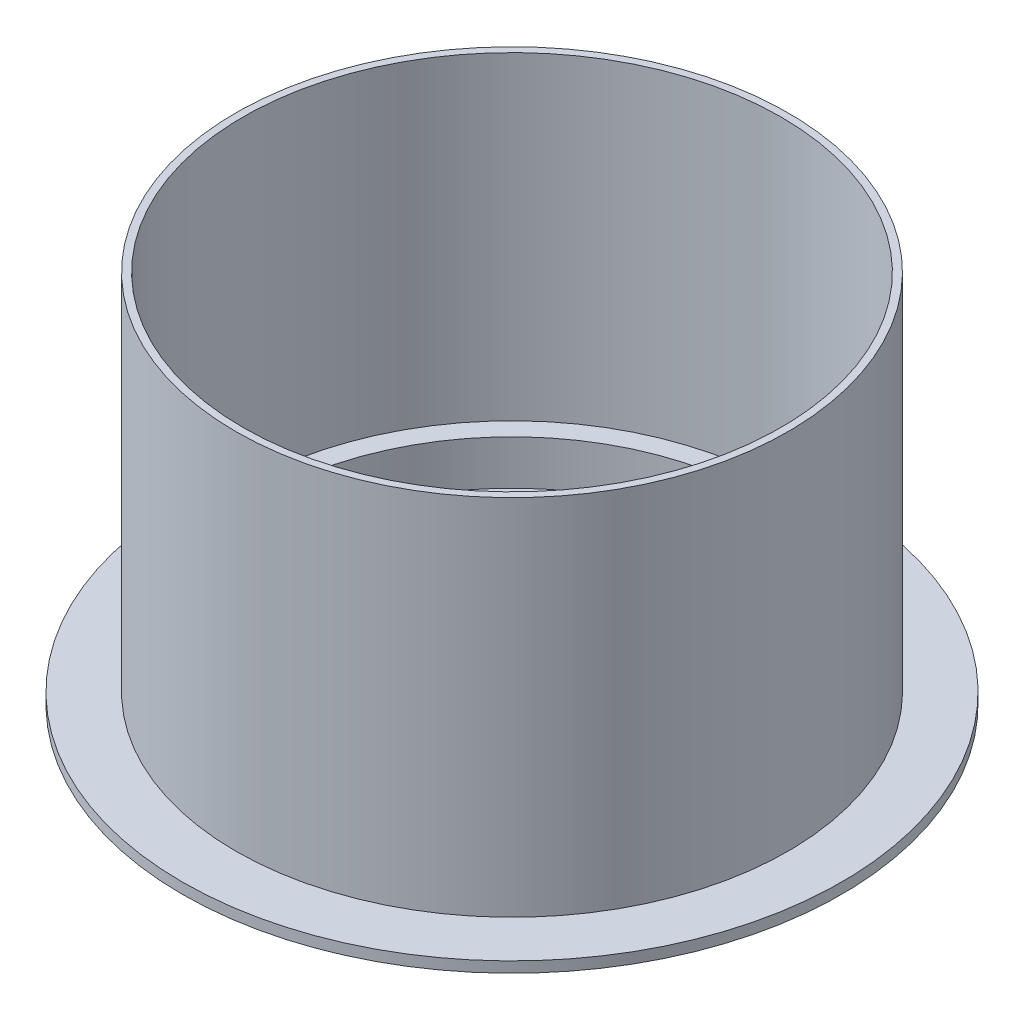
from build123d import *

# Parameters (mm, degrees)
FLOOR_SKETCH_R          = 185
FLOOR_SKETCH_R_2        = 12.5
FLOOR_TANK_LID_DEPTH    = 6
BASKET_LEDGE_SKETCH_R   = 152
BASKET_LEDGE_SKETCH_R_2 = 140
BASKET_LEDGE_DEPTH      = 31
HOUSING_WALL_SKETCH_R   = 155
HOUSING_WALL_SKETCH_R_2 = 151
HOUSING_WALL_DEPTH      = 210


with BuildPart() as part:
    # Floor Sketch → Floor - Tank Lid (new body)
    with BuildSketch(Plane(origin=(0, 0, 0), x_dir=(1, 0, 0), z_dir=(0, 1, 0))):
        Circle(FLOOR_SKETCH_R)
        Circle(FLOOR_SKETCH_R_2, mode=Mode.SUBTRACT)
    extrude(amount=FLOOR_TANK_LID_DEPTH)

    # Basket Ledge Sketch → Basket Ledge (add)
    with BuildSketch(Plane(origin=(0, 0, 0), x_dir=(1, 0, 0), z_dir=(0, 1, 0))):
        Circle(BASKET_LEDGE_SKETCH_R)
        Circle(BASKET_LEDGE_SKETCH_R_2, mode=Mode.SUBTRACT)
    extrude(amount=BASKET_LEDGE_DEPTH)

    # Housing Wall Sketch → Housing Wall (add)
    with BuildSketch(Plane(origin=(0, 0, 0), x_dir=(1, 0, 0), z_dir=(0, 1, 0))):
        Circle(HOUSING_WALL_SKETCH_R)
        Circle(HOUSING_WALL_SKETCH_R_2, mode=Mode.SUBTRACT)
    extrude(amount=HOUSING_WALL_DEPTH)


solid = part.part
